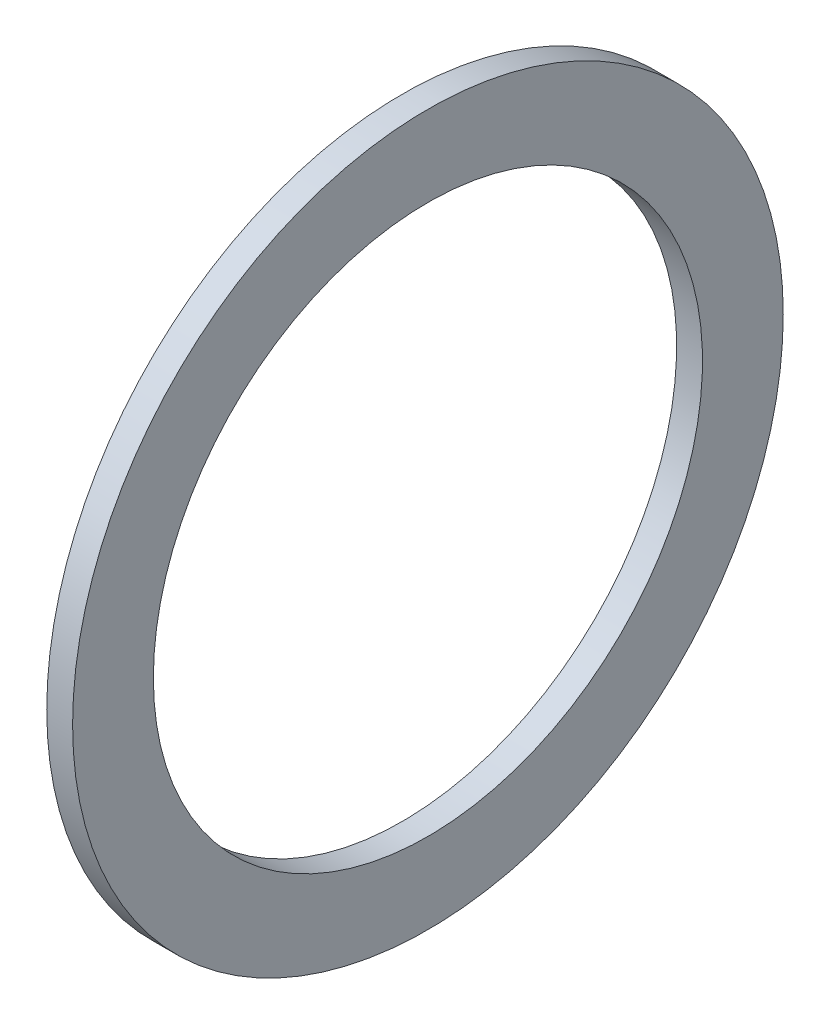
from build123d import *

# Parameters (mm, degrees)
SKETCH3_W = 4.000000128
SKETCH3_H = 12.500000019


with BuildPart() as part:
    # Sketch3 → Revolve1 (revolve)
    with BuildSketch(Plane.XY):
        with Locations((6.999999716, 48.749999973)):
            Rectangle(SKETCH3_W, SKETCH3_H)
    revolve(axis=Axis((0, 0, 0), (1, 0, 0)))


solid = part.part
